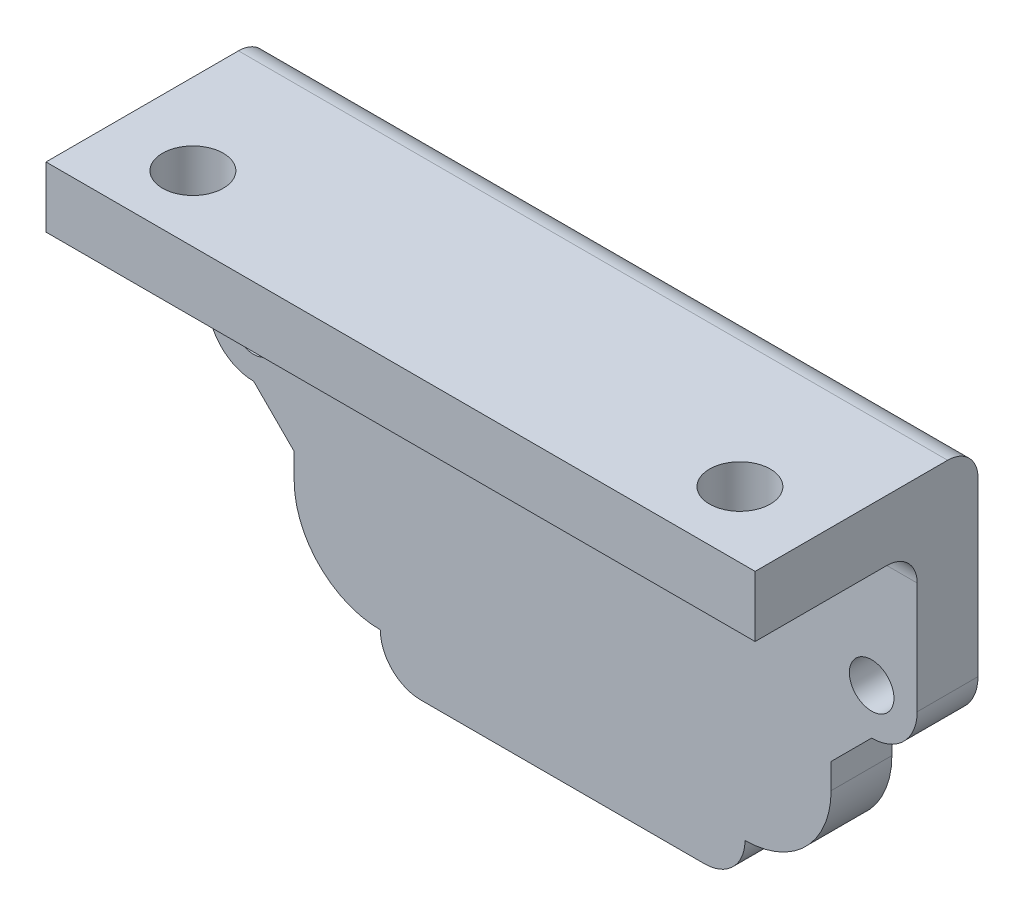
from build123d import *

# Parameters (mm, degrees)
SKETCH_1_R          = 1.1
EXTRUDE_1_DEPTH     = 3
SKETCH_2_W          = 35
SKETCH_2_H          = 11
EXTRUDE_2_DEPTH     = 3
FILLET_1_R          = 1.5
SKETCH_3_R          = 1.5
CUT_EXTRUDE_1_DEPTH = 3
FILLET_2_R          = 2


with BuildPart() as part:
    # 草图1 → 凸台-拉伸1 (new body)
    with BuildSketch(Plane.XY):
        with BuildLine():
            Line((-13.25, -3.875), (-13.25, -2.625))
            Line((-13.25, -2.625), (-15.25, -0.625))
            ThreePointArc((-15.25, -0.625), (-16.840990258, 0.034009742), (-17.5, 1.625))
            Line((-17.5, 1.625), (-17.5, 8.625))
            Line((-17.5, 8.625), (-13.25, 8.625))
            Line((-13.25, 8.625), (13.25, 8.625))
            Line((13.25, 8.625), (17.5, 8.625))
            Line((17.5, 8.625), (17.5, 1.625))
            ThreePointArc((17.5, 1.625), (16.840990258, 0.034009742), (15.25, -0.625))
            Line((15.25, -0.625), (13.25, -2.625))
            Line((13.25, -2.625), (13.25, -3.875))
            ThreePointArc((13.25, -3.875), (12.00520382, -6.88020382), (9, -8.125))
            Line((9, -8.125), (9, -10.125))
            Line((9, -10.125), (-9, -10.125))
            Line((-9, -10.125), (-9, -8.125))
            ThreePointArc((-9, -8.125), (-12.00520382, -6.88020382), (-13.25, -3.875))
        make_face()
        with Locations((-15.25, 1.625)):
            Circle(SKETCH_1_R, mode=Mode.SUBTRACT)
        with Locations((15.25, 1.625)):
            Circle(SKETCH_1_R, mode=Mode.SUBTRACT)
    extrude(amount=EXTRUDE_1_DEPTH)

    # 草图2 → 凸台-拉伸2 (add)
    with BuildSketch(Plane(origin=(0, 8.625, 0), x_dir=(1, 0, 0), z_dir=(0, 1, 0))):
        with Locations((0, -5.5)):
            Rectangle(SKETCH_2_W, SKETCH_2_H)
    extrude(amount=EXTRUDE_2_DEPTH)

    # 圆角1
    fillet_1_edges = [part.edges().sort_by_distance(p)[0] for p in [
        (0, 8.625, 3),
        (0, 11.625, 0),
    ]]
    fillet(fillet_1_edges, radius=FILLET_1_R)

    # 草图3 → 切除-拉伸1 (cut)
    with BuildSketch(Plane.XZ.offset(-8.625)):
        with Locations(Location((13.5, 7.75, 0), (0, 0, 270))):
            Circle(SKETCH_3_R)
        with Locations(Location((-13.5, 7.75, 0), (0, 0, 270))):
            Circle(SKETCH_3_R)
    extrude(amount=-CUT_EXTRUDE_1_DEPTH, mode=Mode.SUBTRACT)

    # 圆角2
    fillet_2_edges = [part.edges().sort_by_distance(p)[0] for p in [
        (9, -10.125, 1.5),
        (-9, -10.125, 1.5),
    ]]
    fillet(fillet_2_edges, radius=FILLET_2_R - 0.0001)  # a hair under: the kernel refuses the full size


solid = part.part
